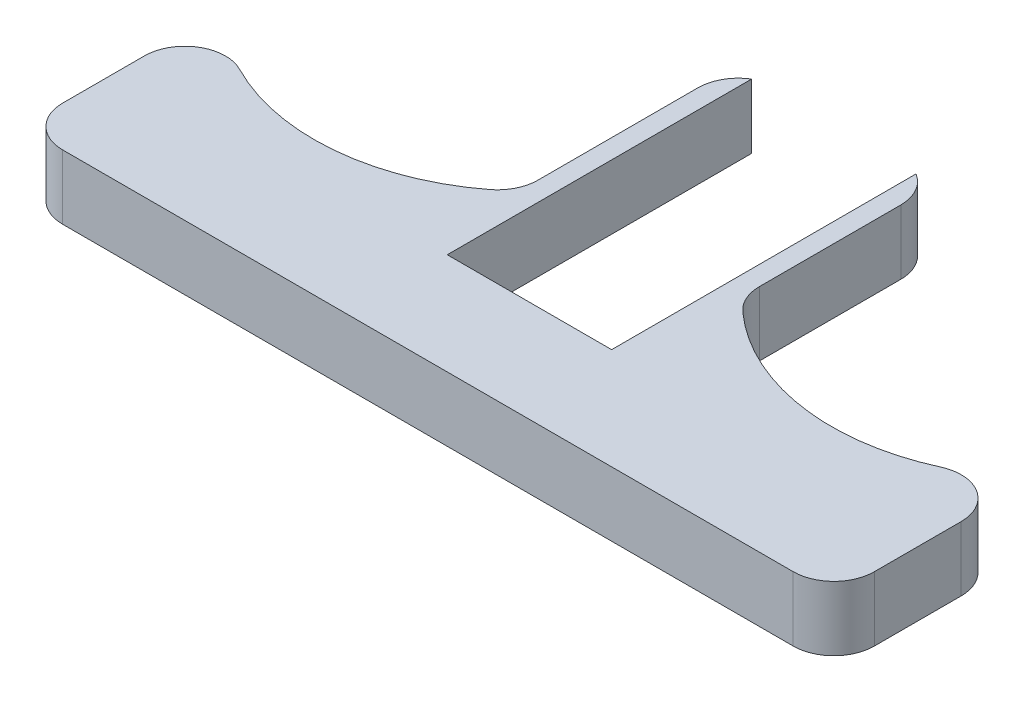
from build123d import *

# Parameters (mm, degrees)
BOSS_EXTRUDE1_DEPTH = 3.175
FILLET1_R           = 2
FILLET2_R           = 2
FILLET3_R           = 2


with BuildPart() as part:
    # Sketch2 → Boss-Extrude1 (new body)
    with BuildSketch(Plane(origin=(0, 0, 0), x_dir=(1, 0, 0), z_dir=(0, 1, 0))):
        with BuildLine():
            Line((0, 0), (40, 0))
            Line((40, 0), (40, 10))
            ThreePointArc((40, 10), (32.396249588, 7.141230333), (25, 10.500557105))
            Line((25, 10.500557105), (25, 20.002146828))
            Line((25, 20.002146828), (24.05, 20.002146828))
            Line((24.05, 20.002146828), (24.05, 5.002146828))
            Line((24.05, 5.002146828), (15.95, 5.002146828))
            Line((15.95, 5.002146828), (15.95, 20.002146828))
            Line((15.95, 20.002146828), (15, 20.002146828))
            Line((15, 20.002146828), (15, 9.499442895))
            ThreePointArc((15, 9.499442895), (7.396249588, 6.640673228), (0, 10))
            Line((0, 10), (0, 0))
        make_face()
    extrude(amount=BOSS_EXTRUDE1_DEPTH)

    # Fillet1
    fillet1_edges = [part.edges().sort_by_distance(p)[0] for p in [
        (15, 1.5875, -9.499442895),
        (25, 1.5875, -10.500557105),
    ]]
    fillet(fillet1_edges, radius=FILLET1_R)

    # Fillet2
    # the kernel refuses this fillet: 2 mm, written as the material it takes off along each edge
    with BuildSketch(Plane(origin=(25, -4.255511133, -20.002146828), x_dir=(0, 0, 1), z_dir=(0, 1, 0))) as fillet2_piece_1:
        with BuildLine():
            CenterArc((1.702204453, -2), FILLET2_R, 90, 58.331756746)
            Line((0, -0.95), (-0.034044089, -0.929))
            ThreePointArc((-0.034044089, -0.929), (-0.04, -0.475), (-0.04, 0))
            Line((-0.04, 0), (0, 0.04))
            Line((0, 0.04), (1.702204453, 0.04))
            Line((1.702204453, 0.04), (1.702204453, 0))
        make_face()
    extrude(amount=11.686022265, mode=Mode.SUBTRACT)
    with BuildSketch(Plane(origin=(15, -4.255511133, -20.002146828), x_dir=(0, 0, 1), z_dir=(0, 1, 0))) as fillet2_piece_2:
        with BuildLine():
            CenterArc((1.702204453, 2), FILLET2_R, 211.668243254, 58.331756746)
            Line((0, 0.95), (-0.034044089, 0.929))
            ThreePointArc((-0.034044089, 0.929), (-0.04, 0.475), (-0.04, 0))
            Line((-0.04, 0), (0, -0.04))
            Line((0, -0.04), (1.702204453, -0.04))
            Line((1.702204453, -0.04), (1.702204453, 0))
        make_face()
    extrude(amount=11.686022265, mode=Mode.SUBTRACT)
    with BuildSketch(Plane(origin=(0, -9.943835684, -10), x_dir=(0, 0, 1), z_dir=(0, 1, 0))) as fillet2_piece_3:
        with BuildLine():
            CenterArc((3.977534274, 2), FILLET2_R, 152.863608887, 117.136391113)
            Line((2.197687698, 2.912220459), (2.162090766, 2.930464868))
            ThreePointArc((2.162090766, 2.930464868), (1.193071422, 1.385002021), (-0.027308932, 0.02922708))
            Line((-0.027308932, 0.02922708), (0, -0.04))
            Line((0, -0.04), (3.977534274, -0.04))
            Line((3.977534274, -0.04), (3.977534274, 0))
        make_face()
    extrude(amount=23.062671369, mode=Mode.SUBTRACT)
    with BuildSketch(Plane(origin=(40, -9.298695448, -10), x_dir=(-0.8303470474110474, 0, 0.5572466068588987), z_dir=(0, 1, 0))) as fillet2_piece_4:
        with BuildLine():
            CenterArc((3.733360689, 1.97396451), FILLET2_R, 146.134404681, 114.610566722)
            Line((2.072666595, 3.088457724), (2.039452713, 3.110747588))
            Line((2.039452713, 3.110747588), (-0.033213882, 0.022289864))
            Line((-0.033213882, 0.022289864), (0.006433168, -0.03947929))
            ThreePointArc((0.006433168, -0.03947929), (1.705851155, 0.098074035), (3.405269143, -0.03947929))
            Line((3.405269143, -0.03947929), (3.411702311, 0))
        make_face()
    extrude(amount=21.772390895, mode=Mode.SUBTRACT)

    # Fillet3
    fillet3_edges = [part.edges().sort_by_distance(p)[0] for p in [
        (40, 1.5875, 0),
        (0, 1.5875, 0),
    ]]
    fillet(fillet3_edges, radius=FILLET3_R)


solid = part.part
